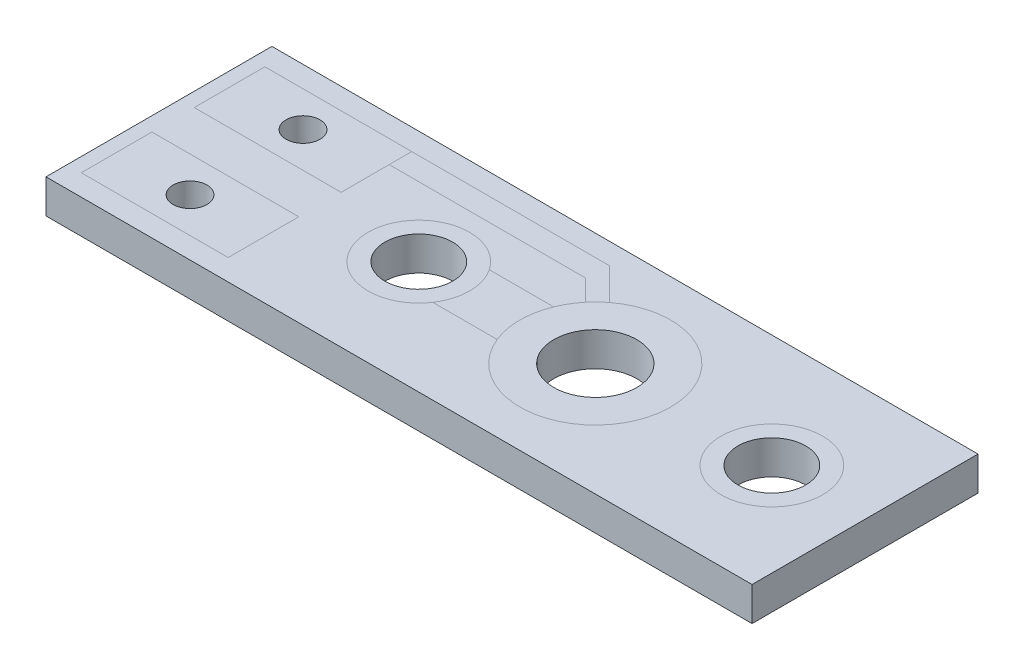
from build123d import *

# Parameters (mm, degrees)
SKETCH2_W           = 31.75
SKETCH2_H           = 10.16
BOSS_EXTRUDE1_DEPTH = 0.762
SKETCH3_R           = 1.524
SKETCH3_R_2         = 1.8669
CUT_EXTRUDE1_DEPTH  = 17.685402872
SKETCH4_R           = 0.762
CUT_EXTRUDE2_DEPTH  = 17.685402872


with BuildPart() as part:
    # Sketch2 → Boss-Extrude1 (new body)
    with BuildSketch(Plane(origin=(0, 0, 0), x_dir=(1, 0, 0), z_dir=(0, 1, 0))):
        Rectangle(SKETCH2_W, SKETCH2_H)
    extrude(amount=BOSS_EXTRUDE1_DEPTH)

    # Sketch3 → Cut-Extrude1 (cut, through all)
    with BuildSketch(Plane(origin=(0, 0.762, 0), x_dir=(1, 0, 0), z_dir=(0, 1, 0))):
        with Locations((-4.191, 0)):
            Circle(SKETCH3_R)
        with Locations((3.7465, 0)):
            Circle(SKETCH3_R_2)
        with Locations((11.684, 0)):
            Circle(SKETCH3_R)
    extrude(amount=-CUT_EXTRUDE1_DEPTH, mode=Mode.SUBTRACT)

    # Sketch4 → Cut-Extrude2 (cut, through all)
    with BuildSketch(Plane(origin=(0, 0.762, 0), x_dir=(1, 0, 0), z_dir=(0, 1, 0))):
        with Locations((-11.938, -2.54)):
            Circle(SKETCH4_R)
    cut_extrude2 = extrude(amount=-CUT_EXTRUDE2_DEPTH, mode=Mode.SUBTRACT)

    # Mirror1: Cut-Extrude2 across plane
    add(cut_extrude2.mirror(Plane.XY), mode=Mode.SUBTRACT)

    # Mirror4: part across plane


with BuildPart() as part_1:
    add(part.part)
    add(part.part.mirror(Plane.ZX))


solid = part_1.part
